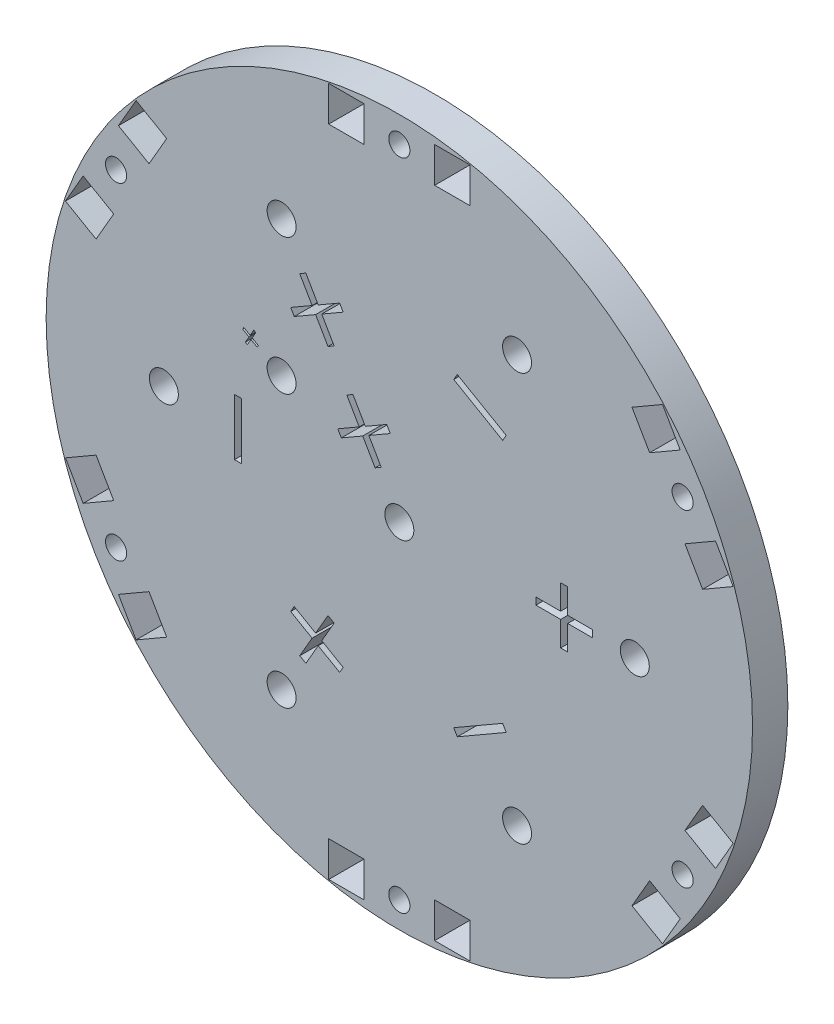
from build123d import *

# Parameters (mm, degrees)
BOSS_EXTRU_1_OUTLINE_R   = 50
BOSS_EXTRU_1_OUTLINE_W   = 5
BOSS_EXTRU_1_OUTLINE_H   = 5
BOSS_EXTRU_1_OUTLINE_R_2 = 2.05
BOSS_EXTRU_1_OUTLINE_R_3 = 1.5
BOSS_EXTRU_1_DEPTH       = 5
SKETCH3_W                = 1
SKETCH3_H                = 8
CUT_EXTRUDE2_DEPTH       = 10


# Read off the part's stored shape, not the designer's step: Boss.-Extru.1
with BuildPart() as part:
    # Boss.-Extru.1 outline → Boss.-Extru.1 (new body)
    with BuildSketch(Plane.XY):
        Circle(BOSS_EXTRU_1_OUTLINE_R)
        Polygon((-37.262039705, -33.060254038), (-39.762039705, -28.730127019), (-35.431912686, -26.230127019), (-32.931912686, -30.560254038), align=None, mode=Mode.SUBTRACT)
        with Locations((-7.5, -46.3)):
            Rectangle(BOSS_EXTRU_1_OUTLINE_W, BOSS_EXTRU_1_OUTLINE_H, mode=Mode.SUBTRACT)
        with Locations((-16.666666667, -28.867513459)):
            Circle(BOSS_EXTRU_1_OUTLINE_R_2, mode=Mode.SUBTRACT)
        with Locations((-40.096976195, -23.15)):
            Circle(BOSS_EXTRU_1_OUTLINE_R_3, mode=Mode.SUBTRACT)
        Polygon((-42.931912686, -13.239745962), (-40.431912686, -17.569872981), (-44.762039705, -20.069872981), (-47.262039705, -15.739745962), align=None, mode=Mode.SUBTRACT)
        with Locations((0, -46.3)):
            Circle(BOSS_EXTRU_1_OUTLINE_R_3, mode=Mode.SUBTRACT)
        with Locations((7.5, -46.3)):
            Rectangle(BOSS_EXTRU_1_OUTLINE_W, BOSS_EXTRU_1_OUTLINE_H, mode=Mode.SUBTRACT)
        with Locations((16.666666667, -28.867513459)):
            Circle(BOSS_EXTRU_1_OUTLINE_R_2, mode=Mode.SUBTRACT)
        Polygon((32.931912686, -30.560254038), (35.431912686, -26.230127019), (39.762039705, -28.730127019), (37.262039705, -33.060254038), align=None, mode=Mode.SUBTRACT)
        with Locations((40.096976195, -23.15)):
            Circle(BOSS_EXTRU_1_OUTLINE_R_3, mode=Mode.SUBTRACT)
        Polygon((47.262039705, -15.739745962), (44.762039705, -20.069872981), (40.431912686, -17.569872981), (42.931912686, -13.239745962), align=None, mode=Mode.SUBTRACT)
        with Locations((-33.333333333, 0)):
            Circle(BOSS_EXTRU_1_OUTLINE_R_2, mode=Mode.SUBTRACT)
        Polygon((-47.262039705, 15.739745962), (-44.762039705, 20.069872981), (-40.431912686, 17.569872981), (-42.931912686, 13.239745962), align=None, mode=Mode.SUBTRACT)
        with Locations((-40.096976195, 23.15)):
            Circle(BOSS_EXTRU_1_OUTLINE_R_3, mode=Mode.SUBTRACT)
        with Locations((-16.671397032, 9.625235564)):
            Circle(BOSS_EXTRU_1_OUTLINE_R_2, mode=Mode.SUBTRACT)
        Polygon((-32.931912686, 30.560254038), (-35.431912686, 26.230127019), (-39.762039705, 28.730127019), (-37.262039705, 33.060254038), align=None, mode=Mode.SUBTRACT)
        with Locations((-16.666666667, 28.867513459)):
            Circle(BOSS_EXTRU_1_OUTLINE_R_2, mode=Mode.SUBTRACT)
        with Locations((-7.5, 46.3)):
            Rectangle(BOSS_EXTRU_1_OUTLINE_W, BOSS_EXTRU_1_OUTLINE_H, mode=Mode.SUBTRACT)
        Circle(BOSS_EXTRU_1_OUTLINE_R_2, mode=Mode.SUBTRACT)
        with Locations((33.333333333, 0)):
            Circle(BOSS_EXTRU_1_OUTLINE_R_2, mode=Mode.SUBTRACT)
        Polygon((42.931912686, 13.239745962), (40.431912686, 17.569872981), (44.762039705, 20.069872981), (47.262039705, 15.739745962), align=None, mode=Mode.SUBTRACT)
        with Locations((40.096976195, 23.15)):
            Circle(BOSS_EXTRU_1_OUTLINE_R_3, mode=Mode.SUBTRACT)
        with Locations((16.666666667, 28.867513459)):
            Circle(BOSS_EXTRU_1_OUTLINE_R_2, mode=Mode.SUBTRACT)
        with Locations((0, 46.3)):
            Circle(BOSS_EXTRU_1_OUTLINE_R_3, mode=Mode.SUBTRACT)
        with Locations((7.5, 46.3)):
            Rectangle(BOSS_EXTRU_1_OUTLINE_W, BOSS_EXTRU_1_OUTLINE_H, mode=Mode.SUBTRACT)
        Polygon((37.262039705, 33.060254038), (39.762039705, 28.730127019), (35.431912686, 26.230127019), (32.931912686, 30.560254038), align=None, mode=Mode.SUBTRACT)
    extrude(amount=BOSS_EXTRU_1_DEPTH)

    # Sketch3 → Cut-Extrude2 (cut)
    with BuildSketch(Plane.XY.offset(5)):
        with Locations((-22.833333333, 0)):
            Rectangle(SKETCH3_W, SKETCH3_H)
        Polygon((-13.233653965, 23.921361037), (-14.099679369, 23.421361037), (-12.349679369, 20.390272124), (-15.380768282, 18.640272124), (-14.880768282, 17.77424672), (-11.849679369, 19.52424672), (-10.099679369, 16.493157806), (-9.233653965, 16.993157806), (-10.983653965, 20.02424672), (-7.952565052, 21.77424672), (-8.452565052, 22.640272124), (-11.483653965, 20.890272124), align=None)
        Polygon((15.130768282, 18.207259422), (14.630768282, 17.341234018), (7.702565052, 21.341234018), (8.202565052, 22.207259422), align=None)
        Polygon((8.202565052, -22.207259422), (7.702565052, -21.341234018), (14.630768282, -17.341234018), (15.130768282, -18.207259422), align=None)
        Polygon((27.333333333, -0.5), (27.333333333, 0.5), (23.833333333, 0.5), (23.833333333, 4), (22.833333333, 4), (22.833333333, 0.5), (19.333333333, 0.5), (19.333333333, -0.5), (22.833333333, -0.5), (22.833333333, -4), (23.833333333, -4), (23.833333333, -0.5), align=None)
        Polygon((-14.099679369, -23.421361037), (-13.233653965, -23.921361037), (-11.483653965, -20.890272124), (-8.452565052, -22.640272124), (-7.952565052, -21.77424672), (-10.983653965, -20.02424672), (-9.233653965, -16.993157806), (-10.099679369, -16.493157806), (-11.849679369, -19.52424672), (-14.880768282, -17.77424672), (-15.380768282, -18.640272124), (-12.349679369, -20.390272124), align=None)
        Polygon((-7.433012703, 11.874355655), (-5.683012702, 8.843266741), (-8.714101616, 7.093266741), (-8.214101616, 6.227241337), (-5.183012702, 7.977241336), (-3.433012703, 4.946152425), (-2.566987299, 5.446152425), (-4.316987299, 8.477241337), (-1.285898385, 10.227241337), (-1.785898385, 11.093266741), (-4.816987299, 9.343266741), (-6.566987299, 12.374355655), align=None)
        Polygon((-20.834234776, 12.184801987), (-19.940304487, 11.668776346), (-20.102964744, 11.386925384), (-20.996895032, 11.902951025), (-21.517828526, 11.000607275), (-21.800380609, 11.163968654), (-21.279447115, 12.066312404), (-22.173377404, 12.582338045), (-22.010717147, 12.864189006), (-21.116786859, 12.348163365), (-20.596554487, 13.24840375), (-20.314002404, 13.085042371), align=None)
    extrude(amount=-CUT_EXTRUDE2_DEPTH, mode=Mode.SUBTRACT)


solid = part.part
